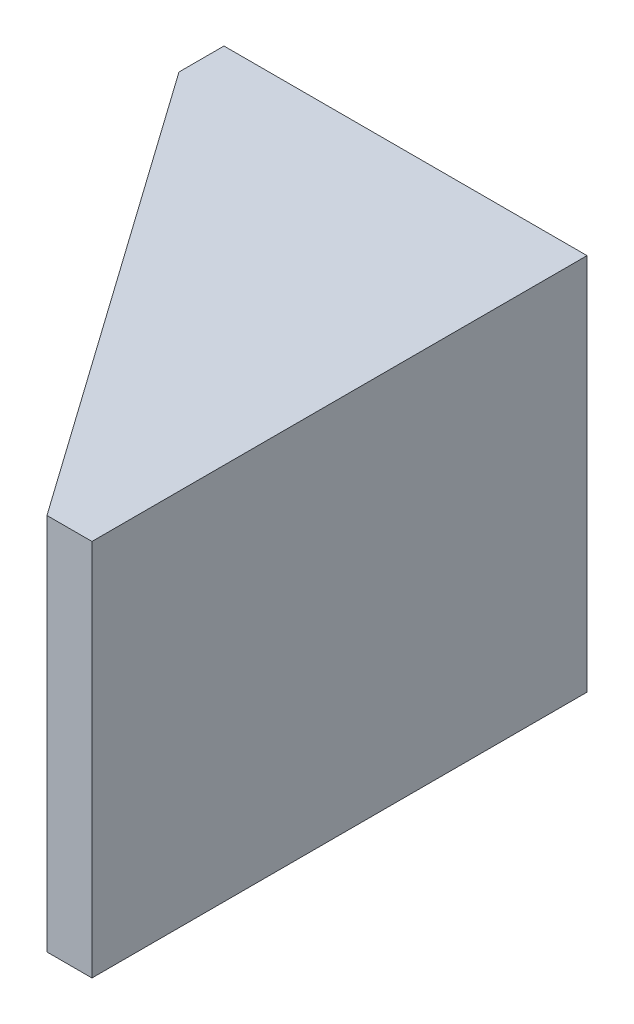
from build123d import *

# Parameters (mm, degrees)
BOSS_EXTRUDE1_DEPTH = 50.4
SKETCH3_R           = 11.5
SKETCH3_R_2         = 1.5
CUT_EXTRUDE1_DEPTH  = 90.095005472
BOSS_EXTRUDE2_DEPTH = 4


with BuildPart() as part:
    # Sketch2 → Boss-Extrude1 (new body)
    with BuildSketch(Plane(origin=(0, 0, 0), x_dir=(1, 0, 0), z_dir=(0, 1, 0))):
        Polygon((-42.4, 0), (0, 0), (0, -60), (6, -60), (6, 6), (-42.4, 6), align=None)
    extrude(amount=BOSS_EXTRUDE1_DEPTH)

    # Sketch3 → Cut-Extrude1 (cut, through all)
    with BuildSketch(Plane.XY):
        with Locations((-21.2, 25.2)):
            Circle(SKETCH3_R)
        with Locations((-36.7, 40.7)):
            Circle(SKETCH3_R_2)
        with Locations((-5.7, 40.7)):
            Circle(SKETCH3_R_2)
        with Locations((-5.7, 9.7)):
            Circle(SKETCH3_R_2)
        with Locations((-36.7, 9.7)):
            Circle(SKETCH3_R_2)
    extrude(amount=-CUT_EXTRUDE1_DEPTH, mode=Mode.SUBTRACT)

    # Sketch4 → Boss-Extrude2 (add)
    with BuildSketch(Plane(origin=(0, 50.4, 0), x_dir=(1, 0, 0), z_dir=(0, 1, 0))):
        Polygon((-42.4, 6), (6, 6), (6, -60), (0, -60), (-42.4, 0), align=None)
    boss_extrude2 = extrude(amount=-BOSS_EXTRUDE2_DEPTH)

    # Mirror1: Boss-Extrude2 across plane
    add(boss_extrude2.mirror(Plane.ZX.offset(25.2)))


solid = part.part
